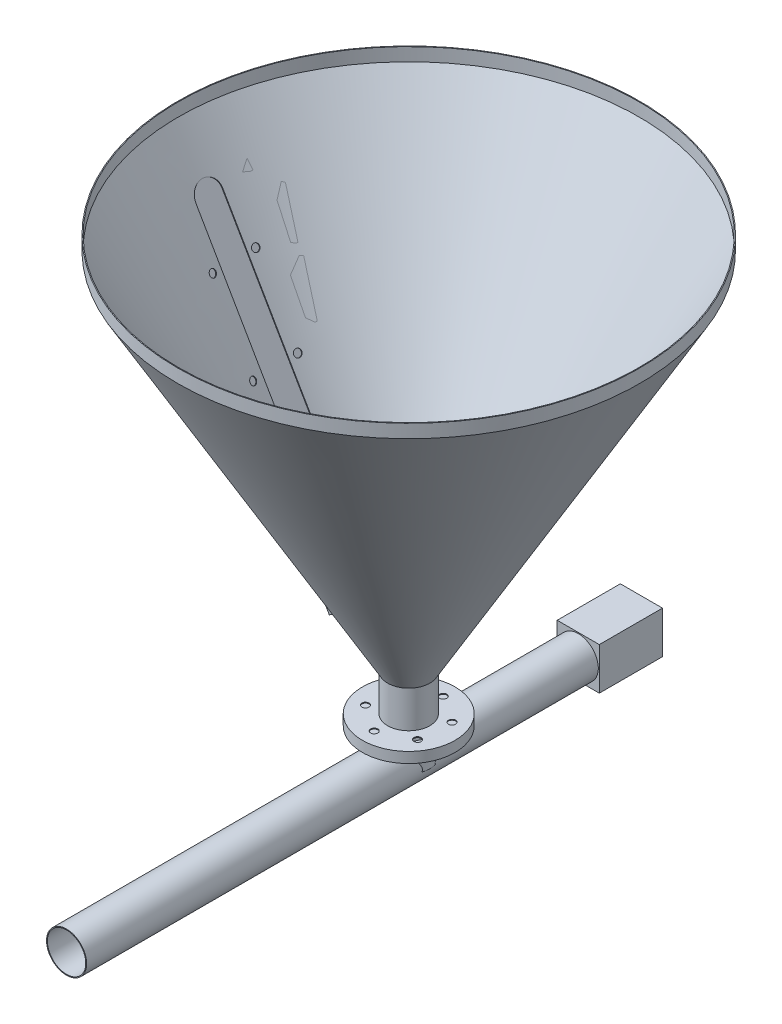
from build123d import *
from OCP.BRepAlgoAPI import BRepAlgoAPI_Cut
from OCP.TopTools import TopTools_ListOfShape

# Parameters (mm, degrees)
CROQUIS1_R                             = 219.5
SALIENTE_EXTRUIR1_DEPTH                = 12.7
CROQUIS3_R                             = 20
CROQUIS2_R                             = 219.5
CROQUIS4_R                             = 20
SALIENTE_EXTRUIR2_DEPTH                = 40
CROQUIS10_R                            = 44
SALIENTE_EXTRUIR6_DEPTH                = 5
CROQUIS15_R                            = 20
SALIENTE_EXTRUIR7_DEPTH                = 25.4
SALIENTE_EXTRUIR3_DEPTH                = 141
SALIENTE_EXTRUIR3_DEPTH_BACK           = 345
CROQUIS5_R                             = 19.05
CROQUIS6_W                             = 40
CROQUIS6_H                             = 40
SALIENTE_EXTRUIR4_DEPTH                = 60
VACIADO1_START                         = -12.487717626
VACIADO1_OUTLINE_R                     = 218.70625
VACIADO1_DEPTH                         = 12.487717626
VACIADO1_START_2                       = -428.60625
VACIADO1_2_OUTLINE_R                   = 19.20625
VACIADO1_2_DEPTH                       = 428.60625
VACIADO1_START_3                       = -403.20625
VACIADO1_3_OUTLINE_R                   = 43.20625
VACIADO1_3_OUTLINE_R_2                 = 19.20625
VACIADO1_3_DEPTH                       = 8.4125
TALADRO_DE_MARGEN_PARA_1_41_AT_2_COUNT = 2
TALADRO_DE_MARGEN_PARA_1_41_AT_2_PITCH = 30.737845776
TALADRO_DE_MARGEN_PARA_1_41_AT_3_COUNT = 2
TALADRO_DE_MARGEN_PARA_1_41_AT_3_PITCH = 53.239510598
TALADRO_DE_MARGEN_PARA_1_41_AT_4_COUNT = 2
TALADRO_DE_MARGEN_PARA_1_41_AT_4_PITCH = 61.475691551
TALADRO_DE_MARGEN_PARA_1_41_AT_5_COUNT = 2
TALADRO_DE_MARGEN_PARA_1_41_AT_5_PITCH = 53.239510598
TALADRO_DE_MARGEN_PARA_1_41_AT_6_COUNT = 2
TALADRO_DE_MARGEN_PARA_1_41_AT_6_PITCH = 30.737845776
CORTAR_EXTRUIR2_REACH                  = 618.272
CROQUIS17_W                            = 56.141480468
CROQUIS17_H                            = 321.518257561
SALIENTE_EXTRUIR8_DEPTH                = 5.5


with BuildPart() as part:
    # Croquis1 → Saliente-Extruir1 (new body)
    with BuildSketch(Plane(origin=(0, 0, 0), x_dir=(1, 0, 0), z_dir=(0, 1, 0))):
        with Locations(Location((0, 0, 0), (0, 0, 270))):
            Circle(CROQUIS1_R)
    extrude(amount=-SALIENTE_EXTRUIR1_DEPTH)

    # Croquis3 → Recubrir1 section 0
    with BuildSketch(Plane(origin=(0, -359, 0), x_dir=(1, 0, 0), z_dir=(0, 1, 0))):
        Circle(CROQUIS3_R)
    # Croquis2 → Recubrir1 section 1
    with BuildSketch(Plane.XZ.offset(12.7)):
        Circle(CROQUIS2_R)
    loft()

    # Croquis4 → Saliente-Extruir2 (add)
    with BuildSketch(Plane.XZ.offset(359)):
        with Locations(Location((0, 0, 0), (0, 0, 270))):
            Circle(CROQUIS4_R)
    extrude(amount=SALIENTE_EXTRUIR2_DEPTH)

    # Croquis10 → Saliente-Extruir6 (add, symmetric)
    with BuildSketch(Plane.XZ.offset(399)):
        with Locations(Location((0, 0, 0), (0, 0, 270))):
            Circle(CROQUIS10_R)
    extrude(amount=SALIENTE_EXTRUIR6_DEPTH, both=True)

    # Croquis15 → Saliente-Extruir7 (add)
    with BuildSketch(Plane.XZ.offset(404)):
        with Locations(Location((0, 0, 0), (0, 0, 270))):
            Circle(CROQUIS15_R)
    extrude(amount=SALIENTE_EXTRUIR7_DEPTH)

    # Croquis5 → Saliente-Extruir3 (add, two sides: drawn at the far end of the back side and taken through both)
    with BuildSketch(Plane(origin=(0, 0, -20), x_dir=(-1, 0, 0), z_dir=(0, 0, -1)).offset(-SALIENTE_EXTRUIR3_DEPTH_BACK)):
        with Locations((0, -427.712858808)):
            Circle(CROQUIS5_R)
    extrude(amount=SALIENTE_EXTRUIR3_DEPTH + SALIENTE_EXTRUIR3_DEPTH_BACK)

    # Vaciado1: read off the stored shape, not the designer's step
    # Vaciado1 outline → Vaciado1 (cut)
    with BuildSketch(Plane(origin=(0, 0, 0), x_dir=(1, 0, 0), z_dir=(0, 1, 0)).offset(VACIADO1_START)):
        Circle(VACIADO1_OUTLINE_R)
    extrude(amount=VACIADO1_DEPTH, mode=Mode.SUBTRACT)

    # Vaciado1 2 outline → Vaciado1 2 (cut)
    with BuildSketch(Plane(origin=(0, 0, 0), x_dir=(1, 0, 0), z_dir=(0, 1, 0)).offset(VACIADO1_START_2)):
        Circle(VACIADO1_2_OUTLINE_R)
    extrude(amount=VACIADO1_2_DEPTH, mode=Mode.SUBTRACT)

    # Vaciado1 3 outline → Vaciado1 3 (cut)
    with BuildSketch(Plane(origin=(0, 0, 0), x_dir=(1, 0, 0), z_dir=(0, 1, 0)).offset(VACIADO1_START_3)):
        Circle(VACIADO1_3_OUTLINE_R)
        Circle(VACIADO1_3_OUTLINE_R_2, mode=Mode.SUBTRACT)
    extrude(amount=VACIADO1_3_DEPTH, mode=Mode.SUBTRACT)

    # Vaciado1 4: loft between two sections, ruled curve by curve
    vaciado1_4_from = [
        Edge.make_three_point_arc((0, -358.787717526, 19.20625), (19.20625, -358.787717526, 0), (0, -358.787717526, -19.20625)),
        Edge.make_three_point_arc((0, -358.787717526, -19.20625), (-19.20625, -358.787717526, 0), (0, -358.787717526, 19.20625)),
    ]
    vaciado1_4_to = [
        Edge.make_three_point_arc((0, -12.487717526, 218.70625), (218.70625, -12.487717526, 0), (0, -12.487717526, -218.70625)),
        Edge.make_three_point_arc((0, -12.487717526, -218.70625), (-218.70625, -12.487717526, 0), (0, -12.487717526, 218.70625)),
    ]
    vaciado1_4 = Solid(Shell([*[Face.make_surface_from_curves(vaciado1_4_from[k], vaciado1_4_to[k]) for k in range(2)], Face(Wire(vaciado1_4_from)), Face(Wire(vaciado1_4_to))]))
    add(vaciado1_4, mode=Mode.SUBTRACT)

    # Vaciado1 5: loft between two sections, ruled curve by curve
    vaciado1_5_from = [
        Edge.make_three_point_arc((-18.25625, -427.712858808, -160.20625), (0, -445.969108808, -160.20625), (18.25625, -427.712858808, -160.20625)),
        Edge.make_three_point_arc((18.25625, -427.712858808, -160.20625), (0, -409.456608808, -160.20625), (-18.25625, -427.712858808, -160.20625)),
    ]
    vaciado1_5_to = [
        Edge.make_three_point_arc((-18.25625, -427.712858808, 325), (0, -445.969108808, 325), (18.25625, -427.712858808, 325)),
        Edge.make_three_point_arc((18.25625, -427.712858808, 325), (0, -409.456608808, 325), (-18.25625, -427.712858808, 325)),
    ]
    vaciado1_5 = Solid(Shell([*[Face.make_surface_from_curves(vaciado1_5_from[k], vaciado1_5_to[k]) for k in range(2)], Face(Wire(vaciado1_5_from)), Face(Wire(vaciado1_5_to))]))
    add(vaciado1_5, mode=Mode.SUBTRACT)

    # Croquis14 → Taladro de margen para 1/41 (revolve, cut)
    with BuildSketch(Plane(origin=(-2.093245115, -394, 30.666488025), x_dir=(0, 0, 1), z_dir=(1, 0, 0))):
        Polygon((0, 0), (0, 14.029827343), (3.3782, 12), (3.3782, 0), align=None)
    taladro_de_margen_para_1_41 = revolve(axis=Axis((-2.093245115, -387.65, 30.666488025), (0, -1, 0)), mode=Mode.SUBTRACT)

    # Taladro de margen para 1/41 at 2: Taladro de margen para 1/41 ×2
    with Locations(*[Vector(-0.8299649657815674, 0, -0.5578155210956409) * (i * TALADRO_DE_MARGEN_PARA_1_41_AT_2_PITCH) for i in range(1, TALADRO_DE_MARGEN_PARA_1_41_AT_2_COUNT)]):
        add(taladro_de_margen_para_1_41, mode=Mode.SUBTRACT)

    # Taladro de margen para 1/41 at 3: Taladro de margen para 1/41 ×2
    with Locations(*[Vector(-0.4398629840700995, 0, -0.8980648947848633) * (i * TALADRO_DE_MARGEN_PARA_1_41_AT_3_PITCH) for i in range(1, TALADRO_DE_MARGEN_PARA_1_41_AT_3_COUNT)]):
        add(taladro_de_margen_para_1_41, mode=Mode.SUBTRACT)

    # Taladro de margen para 1/41 at 4: Taladro de margen para 1/41 ×2
    with Locations(*[Vector(0.06809992900329534, 0, -0.9976785051657403) * (i * TALADRO_DE_MARGEN_PARA_1_41_AT_4_PITCH) for i in range(1, TALADRO_DE_MARGEN_PARA_1_41_AT_4_COUNT)]):
        add(taladro_de_margen_para_1_41, mode=Mode.SUBTRACT)

    # Taladro de margen para 1/41 at 5: Taladro de margen para 1/41 ×2
    with Locations(*[Vector(0.5578155210956407, 0, -0.8299649657815678) * (i * TALADRO_DE_MARGEN_PARA_1_41_AT_5_PITCH) for i in range(1, TALADRO_DE_MARGEN_PARA_1_41_AT_5_COUNT)]):
        add(taladro_de_margen_para_1_41, mode=Mode.SUBTRACT)

    # Taladro de margen para 1/41 at 6: Taladro de margen para 1/41 ×2
    with Locations(*[Vector(0.8980648947848632, 0, -0.4398629840700997) * (i * TALADRO_DE_MARGEN_PARA_1_41_AT_6_PITCH) for i in range(1, TALADRO_DE_MARGEN_PARA_1_41_AT_6_COUNT)]):
        add(taladro_de_margen_para_1_41, mode=Mode.SUBTRACT)

    # Cortar-Extruir2: up to this cone (the profile starts outside it)
    cortar_extruir2_end = Plane(origin=(0, -180.207293, 0), z_dir=(0, 1, 0)).offset(-211.919392825) * Cone(1e-06, 548.88484982, 952.776056608, align=(Align.CENTER, Align.CENTER, Align.MIN), mode=Mode.PRIVATE)
    # Croquis16 → Cortar-Extruir2 (cut, up to the surface)
    with BuildSketch(Plane(origin=(-170.297908692, -98.106938446, 0), x_dir=(0, 0, -1), z_dir=(-0.8664978395701599, -0.4991808229692376, 0)), mode=Mode.PRIVATE) as cortar_extruir2_sk1:
        with BuildLine():
            Line((12.7, 229.749635931), (12.7, -40.250364069))
            ThreePointArc((12.7, -40.250364069), (0, -52.950364069), (-12.7, -40.250364069))
            Line((-12.7, -40.250364069), (-12.7, 229.749635931))
            ThreePointArc((-12.7, 229.749635931), (0, 242.449635931), (12.7, 229.749635931))
        make_face()
    cortar_extruir2_tool1 = extrude(cortar_extruir2_sk1.sketch, amount=-CORTAR_EXTRUIR2_REACH, mode=Mode.PRIVATE) - cortar_extruir2_end
    add(cortar_extruir2_tool1.solids().sort_by_distance((-123.000707, -180.207293, 0))[0], mode=Mode.SUBTRACT)


with BuildPart() as body_2:
    # Croquis6 → Saliente-Extruir4 (new body)
    with BuildSketch(Plane(origin=(0, 0, -161), x_dir=(-1, 0, 0), z_dir=(0, 0, -1))):
        with Locations((0, -427.712858808)):
            Rectangle(CROQUIS6_W, CROQUIS6_H)
    extrude(amount=SALIENTE_EXTRUIR4_DEPTH)


with BuildPart() as body_3:
    # Croquis17 → Saliente-Extruir8 (new body)
    with BuildSketch(Plane(origin=(-170.297908692, -98.106938446, 0), x_dir=(0, 0, -1), z_dir=(-0.8664978395701599, -0.4991808229692376, 0))):
        with Locations((0, 94.934386336)):
            Rectangle(CROQUIS17_W, CROQUIS17_H)
    extrude(amount=SALIENTE_EXTRUIR8_DEPTH)


with BuildPart() as taladro_de_margen_para_1_42_tool:
    # Croquis18 → Taladro de margen para 1/42 (revolve)
    with BuildSketch(Plane(origin=(-126.593084852, -171.075607628, -20.619717549), x_dir=(0.22504104822278623, -0.5998248934760874, 0.7678324190741037), z_dir=(-0.46684343596937267, 0.6253227991574872, 0.6253227991574873))):
        Polygon((0, 0), (0, 24.219827343), (3.3782, 22.19), (3.3782, 0), align=None)
    revolve(axis=Axis((-132.023778201, -174.245405854, -21.504279001), (0.8552272989720918, 0.4991808229692376, 0.13930101605033177)))


with BuildPart() as part_1:
    add(part.part)

    # Taladro de margen para 1/42: cut by taladro_de_margen_para_1_42_tool, with a tolerance
    taladro_de_margen_para_1_42_stock = TopTools_ListOfShape()
    taladro_de_margen_para_1_42_stock.Append(part_1.part.wrapped)
    taladro_de_margen_para_1_42_tools = TopTools_ListOfShape()
    taladro_de_margen_para_1_42_tools.Append(taladro_de_margen_para_1_42_tool.part.wrapped)
    taladro_de_margen_para_1_42_cut = BRepAlgoAPI_Cut()
    taladro_de_margen_para_1_42_cut.SetArguments(taladro_de_margen_para_1_42_stock)
    taladro_de_margen_para_1_42_cut.SetTools(taladro_de_margen_para_1_42_tools)
    taladro_de_margen_para_1_42_cut.SetFuzzyValue(0.00001)
    taladro_de_margen_para_1_42_cut.Build()
    add(Compound.cast(taladro_de_margen_para_1_42_cut.Shape()).solids(), mode=Mode.REPLACE)


with BuildPart() as taladro_de_margen_para_1_42_at_2_tool:
    # Croquis18 at point 2 (carried to point 2, square into its face) → Taladro de margen para 1/42 at 2 (revolve)
    with BuildSketch(Plane(origin=(-165.884145804, -103.692292296, -19.956385548), x_dir=(0.247652081, -0.586666223, 0.771032547), z_dir=(-0.445602276, 0.637684261, 0.62832905))):
        Polygon((0, 0), (0, 24.219827343), (3.3782, 22.19), (3.3782, 0), align=None)
    revolve(axis=Axis((-171.347017471, -106.862090727, -20.613584958), (0.860294751, 0.499180855, 0.10349597)))


with BuildPart() as part_2:
    add(part_1.part)

    # Taladro de margen para 1/42 at 2: cut by taladro_de_margen_para_1_42_at_2_tool, with a tolerance
    taladro_de_margen_para_1_42_at_2_stock = TopTools_ListOfShape()
    taladro_de_margen_para_1_42_at_2_stock.Append(part_2.part.wrapped)
    taladro_de_margen_para_1_42_at_2_tools = TopTools_ListOfShape()
    taladro_de_margen_para_1_42_at_2_tools.Append(taladro_de_margen_para_1_42_at_2_tool.part.wrapped)
    taladro_de_margen_para_1_42_at_2_cut = BRepAlgoAPI_Cut()
    taladro_de_margen_para_1_42_at_2_cut.SetArguments(taladro_de_margen_para_1_42_at_2_stock)
    taladro_de_margen_para_1_42_at_2_cut.SetTools(taladro_de_margen_para_1_42_at_2_tools)
    taladro_de_margen_para_1_42_at_2_cut.SetFuzzyValue(0.00001)
    taladro_de_margen_para_1_42_at_2_cut.Build()
    add(Compound.cast(taladro_de_margen_para_1_42_at_2_cut.Shape()).solids(), mode=Mode.REPLACE)


with BuildPart() as taladro_de_margen_para_1_42_at_3_tool:
    # Croquis18 at point 3 (carried to point 3, square into its face) → Taladro de margen para 1/42 at 3 (revolve)
    with BuildSketch(Plane(origin=(-88.801050274, -235.427759353, -20.73066527), x_dir=(0.189564863, -0.620670869, 0.760810644), z_dir=(-0.502047039, 0.604636995, 0.618354976))):
        Polygon((0, 0), (0, 24.219827343), (3.3782, 22.19), (3.3782, 0), align=None)
    revolve(axis=Axis((-94.159238572, -238.597559382, -21.981539338), (0.843809181, 0.499181107, 0.196988042)))


with BuildPart() as part_3:
    add(part_2.part)

    # Taladro de margen para 1/42 at 3: cut by taladro_de_margen_para_1_42_at_3_tool, with a tolerance
    taladro_de_margen_para_1_42_at_3_stock = TopTools_ListOfShape()
    taladro_de_margen_para_1_42_at_3_stock.Append(part_3.part.wrapped)
    taladro_de_margen_para_1_42_at_3_tools = TopTools_ListOfShape()
    taladro_de_margen_para_1_42_at_3_tools.Append(taladro_de_margen_para_1_42_at_3_tool.part.wrapped)
    taladro_de_margen_para_1_42_at_3_cut = BRepAlgoAPI_Cut()
    taladro_de_margen_para_1_42_at_3_cut.SetArguments(taladro_de_margen_para_1_42_at_3_stock)
    taladro_de_margen_para_1_42_at_3_cut.SetTools(taladro_de_margen_para_1_42_at_3_tools)
    taladro_de_margen_para_1_42_at_3_cut.SetFuzzyValue(0.00001)
    taladro_de_margen_para_1_42_at_3_cut.Build()
    add(Compound.cast(taladro_de_margen_para_1_42_at_3_cut.Shape()).solids(), mode=Mode.REPLACE)


with BuildPart() as taladro_de_margen_para_1_42_at_4_tool:
    # Croquis18 at point 4 (carried to point 4, square into its face) → Taladro de margen para 1/42 at 4 (revolve)
    with BuildSketch(Plane(origin=(-125.694140338, -171.951450206, 22.864543356), x_dir=(0.422851057, -0.484182873, 0.766005176), z_dir=(-0.307290067, 0.718599545, 0.623848946))):
        Polygon((0, 0), (0, 24.219827343), (3.3782, 22.19), (3.3782, 0), align=None)
    revolve(axis=Axis((-131.107565795, -175.121249355, 23.849275894), (0.852507946, 0.499180968, -0.15507599)))


with BuildPart() as part_4:
    add(part_3.part)

    # Taladro de margen para 1/42 at 4: cut by taladro_de_margen_para_1_42_at_4_tool, with a tolerance
    taladro_de_margen_para_1_42_at_4_stock = TopTools_ListOfShape()
    taladro_de_margen_para_1_42_at_4_stock.Append(part_4.part.wrapped)
    taladro_de_margen_para_1_42_at_4_tools = TopTools_ListOfShape()
    taladro_de_margen_para_1_42_at_4_tools.Append(taladro_de_margen_para_1_42_at_4_tool.part.wrapped)
    taladro_de_margen_para_1_42_at_4_cut = BRepAlgoAPI_Cut()
    taladro_de_margen_para_1_42_at_4_cut.SetArguments(taladro_de_margen_para_1_42_at_4_stock)
    taladro_de_margen_para_1_42_at_4_cut.SetTools(taladro_de_margen_para_1_42_at_4_tools)
    taladro_de_margen_para_1_42_at_4_cut.SetFuzzyValue(0.00001)
    taladro_de_margen_para_1_42_at_4_cut.Build()
    add(Compound.cast(taladro_de_margen_para_1_42_at_4_cut.Shape()).solids(), mode=Mode.REPLACE)


with BuildPart() as taladro_de_margen_para_1_42_at_5_tool:
    # Croquis18 at point 5 (carried to point 5, square into its face) → Taladro de margen para 1/42 at 5 (revolve)
    with BuildSketch(Plane(origin=(-87.995811481, -235.11079862, 24.606081958), x_dir=(0.479588037, -0.44942669, 0.753665022), z_dir=(-0.27134326, 0.740833399, 0.614441788))):
        Polygon((0, 0), (0, 24.219827343), (3.3782, 22.19), (3.3782, 0), align=None)
    revolve(axis=Axis((-93.294802396, -238.280597051, 26.087828629), (0.834486758, 0.499180855, -0.233345932)))


with BuildPart() as part_5:
    add(part_4.part)

    # Taladro de margen para 1/42 at 5: cut by taladro_de_margen_para_1_42_at_5_tool, with a tolerance
    taladro_de_margen_para_1_42_at_5_stock = TopTools_ListOfShape()
    taladro_de_margen_para_1_42_at_5_stock.Append(part_5.part.wrapped)
    taladro_de_margen_para_1_42_at_5_tools = TopTools_ListOfShape()
    taladro_de_margen_para_1_42_at_5_tools.Append(taladro_de_margen_para_1_42_at_5_tool.part.wrapped)
    taladro_de_margen_para_1_42_at_5_cut = BRepAlgoAPI_Cut()
    taladro_de_margen_para_1_42_at_5_cut.SetArguments(taladro_de_margen_para_1_42_at_5_stock)
    taladro_de_margen_para_1_42_at_5_cut.SetTools(taladro_de_margen_para_1_42_at_5_tools)
    taladro_de_margen_para_1_42_at_5_cut.SetFuzzyValue(0.00001)
    taladro_de_margen_para_1_42_at_5_cut.Build()
    add(Compound.cast(taladro_de_margen_para_1_42_at_5_cut.Shape()).solids(), mode=Mode.REPLACE)


with BuildPart() as taladro_de_margen_para_1_42_at_6_tool:
    # Croquis18 at point 6 (carried to point 6, square into its face) → Taladro de margen para 1/42 at 6 (revolve)
    with BuildSketch(Plane(origin=(-165.528348533, -104.012631282, 21.31993646), x_dir=(0.391398381, -0.502961332, 0.770608335), z_dir=(-0.329000153, 0.705583712, 0.627622916))):
        Polygon((0, 0), (0, 24.219827343), (3.3782, 22.19), (3.3782, 0), align=None)
    revolve(axis=Axis((-170.985530578, -107.1824297, 22.022817753), (0.859398747, 0.499180853, -0.110689967)))


with BuildPart() as part_6:
    add(part_5.part)

    # Taladro de margen para 1/42 at 6: cut by taladro_de_margen_para_1_42_at_6_tool, with a tolerance
    taladro_de_margen_para_1_42_at_6_stock = TopTools_ListOfShape()
    taladro_de_margen_para_1_42_at_6_stock.Append(part_6.part.wrapped)
    taladro_de_margen_para_1_42_at_6_tools = TopTools_ListOfShape()
    taladro_de_margen_para_1_42_at_6_tools.Append(taladro_de_margen_para_1_42_at_6_tool.part.wrapped)
    taladro_de_margen_para_1_42_at_6_cut = BRepAlgoAPI_Cut()
    taladro_de_margen_para_1_42_at_6_cut.SetArguments(taladro_de_margen_para_1_42_at_6_stock)
    taladro_de_margen_para_1_42_at_6_cut.SetTools(taladro_de_margen_para_1_42_at_6_tools)
    taladro_de_margen_para_1_42_at_6_cut.SetFuzzyValue(0.00001)
    taladro_de_margen_para_1_42_at_6_cut.Build()
    add(Compound.cast(taladro_de_margen_para_1_42_at_6_cut.Shape()).solids(), mode=Mode.REPLACE)


solid = Compound([body_2.part, body_3.part, part_6.part])
